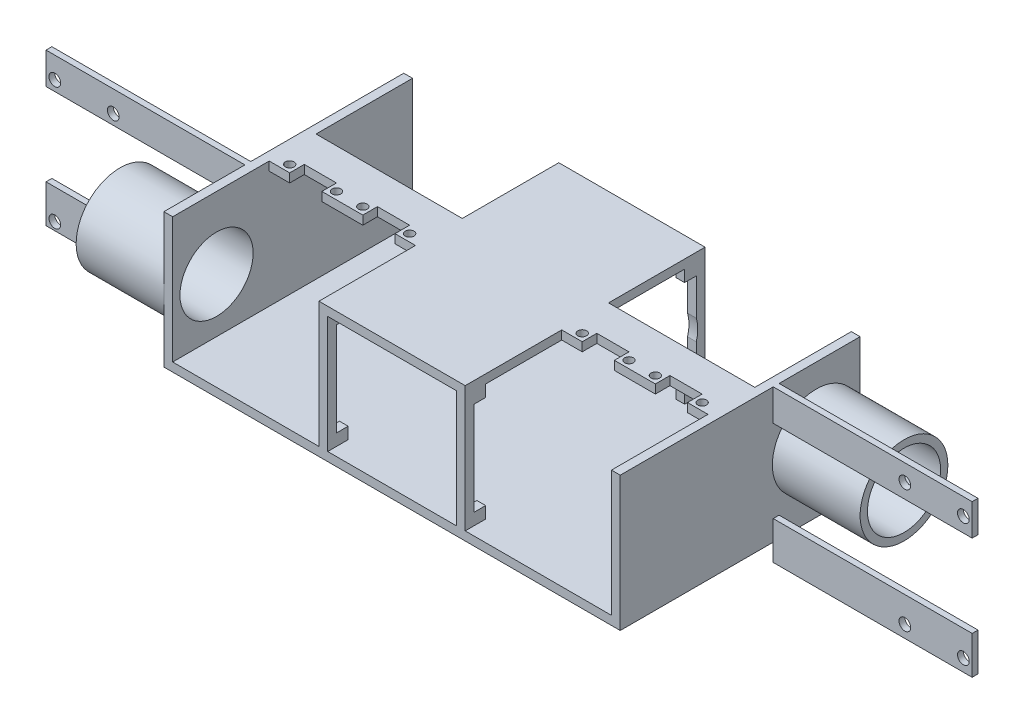
from build123d import *

# Parameters (mm, degrees)
SKETCH1_W               = 50
SKETCH1_H               = 46
BOSS_EXTRUDE1_DEPTH     = 41
CUT_EXTRUDE1_REACH      = 90.758
SKETCH2_W               = 44
SKETCH2_H               = 40
CUT_EXTRUDE2_DEPTH      = 69.629439747
CUT_EXTRUDE2_DEPTH_BACK = 69.629439747
SKETCH4_W               = 82
SKETCH4_H               = 3
BOSS_EXTRUDE2_DEPTH     = 50
SKETCH7_W               = 16
SKETCH7_H               = 3
BOSS_EXTRUDE4_DEPTH     = 50
SKETCH8_W               = 82
SKETCH8_H               = 46
BOSS_EXTRUDE5_DEPTH     = 3
CUT_EXTRUDE4_START      = -3
CUT_EXTRUDE4_DEPTH      = 103.403219264
CUT_EXTRUDE5_REACH      = 101.403
SKETCH10_W              = 11
SKETCH10_H              = 5
CUT_EXTRUDE6_REACH      = 101.403
SKETCH11_R              = 1.5
SKETCH12_R              = 15
BOSS_EXTRUDE6_DEPTH     = 30
SKETCH13_R              = 12.5
CUT_EXTRUDE7_DEPTH      = 142.063815346
SKETCH14_W              = 2
SKETCH14_H              = 10.8
SKETCH14_H_2            = 13
BOSS_EXTRUDE7_DEPTH     = 68
SKETCH16_R              = 15
BOSS_EXTRUDE8_DEPTH     = 30
CUT_EXTRUDE9_REACH      = 260.917
SKETCH17_R              = 12.5
SKETCH18_W              = 2
SKETCH18_H              = 10.8
BOSS_EXTRUDE9_DEPTH     = 68
SKETCH19_W              = 2
SKETCH19_H              = 13
BOSS_EXTRUDE10_DEPTH    = 68
CUT_EXTRUDE10_REACH     = 160.447
SKETCH15_R              = 2
CUT_EXTRUDE11_REACH     = 160.447
SKETCH20_R              = 2


with BuildPart() as part:
    # Sketch1 → Boss-Extrude1 (new, symmetric)
    with BuildSketch(Plane.XY):
        Rectangle(SKETCH1_W, SKETCH1_H)
    extrude(amount=BOSS_EXTRUDE1_DEPTH, both=True)

    # Sketch2 → Cut-Extrude1 (cut, up to next)
    with BuildSketch(Plane.XY.offset(41), mode=Mode.PRIVATE) as cut_extrude1_sk1:
        Rectangle(SKETCH2_W, SKETCH2_H)
    cut_extrude1_tool1 = extrude(cut_extrude1_sk1.sketch, amount=-CUT_EXTRUDE1_REACH, mode=Mode.PRIVATE) & part.part
    add(cut_extrude1_tool1.solids().sort_by_distance((0, 0, 41))[0], mode=Mode.SUBTRACT)

    # Sketch3 → Cut-Extrude2 (cut, two sides: drawn at the far end of the back side and taken through both)
    with BuildSketch(Plane.ZY.offset(25).offset(-CUT_EXTRUDE2_DEPTH_BACK)):
        Polygon((-34, 16), (-34, 20), (34, 20), (34, 16), (38, 16), (38, -16), (34, -16), (34, -20), (-34, -20), (-34, -16), (-38, -16), (-38, 16), align=None)
    extrude(amount=CUT_EXTRUDE2_DEPTH + CUT_EXTRUDE2_DEPTH_BACK, mode=Mode.SUBTRACT)

    # Sketch4 → Boss-Extrude2 (add)
    with BuildSketch(Plane(origin=(25, 0, 0), x_dir=(0, 0, -1), z_dir=(1, 0, 0))):
        with Locations((0, -21.5)):
            Rectangle(SKETCH4_W, SKETCH4_H)
    boss_extrude2 = extrude(amount=BOSS_EXTRUDE2_DEPTH)

    # Sketch7 → Boss-Extrude4 (add)
    with BuildSketch(Plane(origin=(25, 0, 0), x_dir=(0, 0, -1), z_dir=(1, 0, 0))):
        with Locations((0, 21.5)):
            Rectangle(SKETCH7_W, SKETCH7_H)
    boss_extrude4 = extrude(amount=BOSS_EXTRUDE4_DEPTH)

    # Sketch8 → Boss-Extrude5 (add)
    with BuildSketch(Plane(origin=(75, 0, 0), x_dir=(0, 0, -1), z_dir=(1, 0, 0))):
        Rectangle(SKETCH8_W, SKETCH8_H)
    boss_extrude5 = extrude(amount=BOSS_EXTRUDE5_DEPTH)

    # Sketch9 → Cut-Extrude4 (cut)
    with BuildSketch(Plane(origin=(0, 23, 0), x_dir=(1, 0, 0), z_dir=(0, 1, 0)).offset(CUT_EXTRUDE4_START)):
        Polygon((68, -228.237960416), (68, -8), (68, -3), (57, -3), (57, -8), (57, -228.237960416), (57, -668.713881249), (68, -668.713881249), align=None)
    cut_extrude4 = extrude(amount=CUT_EXTRUDE4_DEPTH, mode=Mode.SUBTRACT)

    # Sketch10 → Cut-Extrude5 (cut, up to next)
    with BuildSketch(Plane(origin=(0, 23, 0), x_dir=(1, 0, 0), z_dir=(0, 1, 0)), mode=Mode.PRIVATE) as cut_extrude5_sk1:
        with Locations((37.5, -5.5)):
            Rectangle(SKETCH10_W, SKETCH10_H)
    cut_extrude5_tool1 = extrude(cut_extrude5_sk1.sketch, amount=-CUT_EXTRUDE5_REACH, mode=Mode.PRIVATE) & part.part
    cut_extrude5 = cut_extrude5_tool1.solids().sort_by_distance((37.5, 23, 5.5))[0]
    add(cut_extrude5, mode=Mode.SUBTRACT)

    # Sketch11 → Cut-Extrude6 (cut, up to next)
    with BuildSketch(Plane(origin=(0, 23, 0), x_dir=(1, 0, 0), z_dir=(0, 1, 0)), mode=Mode.PRIVATE) as cut_extrude6_sk1:
        with Locations((29.5, -5.5)):
            Circle(SKETCH11_R)
    cut_extrude6_tool1 = extrude(cut_extrude6_sk1.sketch, amount=-CUT_EXTRUDE6_REACH, mode=Mode.PRIVATE) & part.part
    # Sketch11 → Cut-Extrude6 (cut, up to next)
    with BuildSketch(Plane(origin=(0, 23, 0), x_dir=(1, 0, 0), z_dir=(0, 1, 0)), mode=Mode.PRIVATE) as cut_extrude6_sk2:
        with Locations((45.5, -5.5)):
            Circle(SKETCH11_R)
    cut_extrude6_tool2 = extrude(cut_extrude6_sk2.sketch, amount=-CUT_EXTRUDE6_REACH, mode=Mode.PRIVATE) & part.part
    # Sketch11 → Cut-Extrude6 (cut, up to next)
    with BuildSketch(Plane(origin=(0, 23, 0), x_dir=(1, 0, 0), z_dir=(0, 1, 0)), mode=Mode.PRIVATE) as cut_extrude6_sk3:
        with Locations((54.5, -5.5)):
            Circle(SKETCH11_R)
    cut_extrude6_tool3 = extrude(cut_extrude6_sk3.sketch, amount=-CUT_EXTRUDE6_REACH, mode=Mode.PRIVATE) & part.part
    # Sketch11 → Cut-Extrude6 (cut, up to next)
    with BuildSketch(Plane(origin=(0, 23, 0), x_dir=(1, 0, 0), z_dir=(0, 1, 0)), mode=Mode.PRIVATE) as cut_extrude6_sk4:
        with Locations((70.5, -5.5)):
            Circle(SKETCH11_R)
    cut_extrude6_tool4 = extrude(cut_extrude6_sk4.sketch, amount=-CUT_EXTRUDE6_REACH, mode=Mode.PRIVATE) & part.part
    cut_extrude6_1 = cut_extrude6_tool1.solids().sort_by_distance((29.5, 23, 5.5))[0]
    add(cut_extrude6_1, mode=Mode.SUBTRACT)
    cut_extrude6_2 = cut_extrude6_tool2.solids().sort_by_distance((45.5, 23, 5.5))[0]
    add(cut_extrude6_2, mode=Mode.SUBTRACT)
    cut_extrude6_3 = cut_extrude6_tool3.solids().sort_by_distance((54.5, 23, 5.5))[0]
    add(cut_extrude6_3, mode=Mode.SUBTRACT)
    cut_extrude6_4 = cut_extrude6_tool4.solids().sort_by_distance((70.5, 23, 5.5))[0]
    add(cut_extrude6_4, mode=Mode.SUBTRACT)
    cut_extrude6 = cut_extrude6_1 + cut_extrude6_2 + cut_extrude6_3 + cut_extrude6_4  # Cut-Extrude6 as one shape, for the pattern or mirror that repeats it

    # Sketch12 → Boss-Extrude6 (add)
    with BuildSketch(Plane(origin=(78, 0, 0), x_dir=(0, 0, -1), z_dir=(1, 0, 0))):
        with Locations((26, 0)):
            Circle(SKETCH12_R)
    extrude(amount=BOSS_EXTRUDE6_DEPTH)

    # Sketch13 → Cut-Extrude7 (cut, through all)
    with BuildSketch(Plane(origin=(108, 0, 0), x_dir=(0, 0, -1), z_dir=(1, 0, 0))):
        with Locations((26, 0)):
            Circle(SKETCH13_R)
    extrude(amount=-CUT_EXTRUDE7_DEPTH, mode=Mode.SUBTRACT)

    # Sketch14 → Boss-Extrude7 (add)
    with BuildSketch(Plane(origin=(78, 0, 0), x_dir=(0, 0, -1), z_dir=(1, 0, 0))):
        with Locations((12.3, 17.6)):
            Rectangle(SKETCH14_W, SKETCH14_H)
        with Locations((12.3, -22.5)):
            Rectangle(SKETCH14_W, SKETCH14_H_2)
    extrude(amount=BOSS_EXTRUDE7_DEPTH)

    # Mirror1: Boss-Extrude2, Boss-Extrude4, Boss-Extrude5, Cut-Extrude4, Cut-Extrude5, Cut-Extrude6 across plane
    add(boss_extrude2.mirror(Plane(origin=(0, 0, 0), x_dir=(0, 0, 1), z_dir=(1, 0, 0))))
    add(boss_extrude4.mirror(Plane(origin=(0, 0, 0), x_dir=(0, 0, 1), z_dir=(1, 0, 0))))
    add(boss_extrude5.mirror(Plane(origin=(0, 0, 0), x_dir=(0, 0, 1), z_dir=(1, 0, 0))))
    add(cut_extrude4.mirror(Plane(origin=(0, 0, 0), x_dir=(0, 0, 1), z_dir=(1, 0, 0))), mode=Mode.SUBTRACT)
    add(cut_extrude5.mirror(Plane(origin=(0, 0, 0), x_dir=(0, 0, 1), z_dir=(1, 0, 0))), mode=Mode.SUBTRACT)
    add(cut_extrude6.mirror(Plane(origin=(0, 0, 0), x_dir=(0, 0, 1), z_dir=(1, 0, 0))), mode=Mode.SUBTRACT)

    # Sketch16 → Boss-Extrude8 (add)
    with BuildSketch(Plane.ZY.offset(78)):
        with Locations((26, -1.505120408)):
            Circle(SKETCH16_R)
    extrude(amount=BOSS_EXTRUDE8_DEPTH)

    # Sketch17 → Cut-Extrude9 (cut, up to next)
    with BuildSketch(Plane.ZY.offset(108), mode=Mode.PRIVATE) as cut_extrude9_sk1:
        with Locations((26, -1.505120408)):
            Circle(SKETCH17_R)
    cut_extrude9_tool1 = extrude(cut_extrude9_sk1.sketch, amount=-CUT_EXTRUDE9_REACH, mode=Mode.PRIVATE) & part.part
    add(cut_extrude9_tool1.solids().sort_by_distance((-108, -1.50512, 26))[0], mode=Mode.SUBTRACT)

    # Sketch18 → Boss-Extrude9 (add)
    with BuildSketch(Plane.ZY.offset(78)):
        with Locations((12.3, 17.6)):
            Rectangle(SKETCH18_W, SKETCH18_H)
    extrude(amount=BOSS_EXTRUDE9_DEPTH)

    # Sketch19 → Boss-Extrude10 (add)
    with BuildSketch(Plane.ZY.offset(78)):
        with Locations((12.3, -22.5)):
            Rectangle(SKETCH19_W, SKETCH19_H)
    extrude(amount=BOSS_EXTRUDE10_DEPTH)

    # Sketch15 → Cut-Extrude10 (cut, up to next)
    with BuildSketch(Plane(origin=(0, 0, -13.3), x_dir=(-1, 0, 0), z_dir=(0, 0, -1)), mode=Mode.PRIVATE) as cut_extrude10_sk1:
        with Locations((-143, -24.8)):
            Circle(SKETCH15_R)
    cut_extrude10_tool1 = extrude(cut_extrude10_sk1.sketch, amount=-CUT_EXTRUDE10_REACH, mode=Mode.PRIVATE) & part.part
    # Sketch15 → Cut-Extrude10 (cut, up to next)
    with BuildSketch(Plane(origin=(0, 0, -13.3), x_dir=(-1, 0, 0), z_dir=(0, 0, -1)), mode=Mode.PRIVATE) as cut_extrude10_sk2:
        with Locations((-123, -24.8)):
            Circle(SKETCH15_R)
    cut_extrude10_tool2 = extrude(cut_extrude10_sk2.sketch, amount=-CUT_EXTRUDE10_REACH, mode=Mode.PRIVATE) & part.part
    # Sketch15 → Cut-Extrude10 (cut, up to next)
    with BuildSketch(Plane(origin=(0, 0, -13.3), x_dir=(-1, 0, 0), z_dir=(0, 0, -1)), mode=Mode.PRIVATE) as cut_extrude10_sk3:
        with Locations((-123, 17.2)):
            Circle(SKETCH15_R)
    cut_extrude10_tool3 = extrude(cut_extrude10_sk3.sketch, amount=-CUT_EXTRUDE10_REACH, mode=Mode.PRIVATE) & part.part
    # Sketch15 → Cut-Extrude10 (cut, up to next)
    with BuildSketch(Plane(origin=(0, 0, -13.3), x_dir=(-1, 0, 0), z_dir=(0, 0, -1)), mode=Mode.PRIVATE) as cut_extrude10_sk4:
        with Locations((-143, 17.2)):
            Circle(SKETCH15_R)
    cut_extrude10_tool4 = extrude(cut_extrude10_sk4.sketch, amount=-CUT_EXTRUDE10_REACH, mode=Mode.PRIVATE) & part.part
    add(cut_extrude10_tool1.solids().sort_by_distance((143, -24.8, -13.3))[0], mode=Mode.SUBTRACT)
    add(cut_extrude10_tool2.solids().sort_by_distance((123, -24.8, -13.3))[0], mode=Mode.SUBTRACT)
    add(cut_extrude10_tool3.solids().sort_by_distance((123, 17.2, -13.3))[0], mode=Mode.SUBTRACT)
    add(cut_extrude10_tool4.solids().sort_by_distance((143, 17.2, -13.3))[0], mode=Mode.SUBTRACT)

    # Sketch20 → Cut-Extrude11 (cut, up to next)
    with BuildSketch(Plane.XY.offset(13.3), mode=Mode.PRIVATE) as cut_extrude11_sk1:
        with Locations((-123, 15.694879592)):
            Circle(SKETCH20_R)
    cut_extrude11_tool1 = extrude(cut_extrude11_sk1.sketch, amount=-CUT_EXTRUDE11_REACH, mode=Mode.PRIVATE) & part.part
    # Sketch20 → Cut-Extrude11 (cut, up to next)
    with BuildSketch(Plane.XY.offset(13.3), mode=Mode.PRIVATE) as cut_extrude11_sk2:
        with Locations((-143, 15.694879592)):
            Circle(SKETCH20_R)
    cut_extrude11_tool2 = extrude(cut_extrude11_sk2.sketch, amount=-CUT_EXTRUDE11_REACH, mode=Mode.PRIVATE) & part.part
    # Sketch20 → Cut-Extrude11 (cut, up to next)
    with BuildSketch(Plane.XY.offset(13.3), mode=Mode.PRIVATE) as cut_extrude11_sk3:
        with Locations((-123, -26.305120408)):
            Circle(SKETCH20_R)
    cut_extrude11_tool3 = extrude(cut_extrude11_sk3.sketch, amount=-CUT_EXTRUDE11_REACH, mode=Mode.PRIVATE) & part.part
    # Sketch20 → Cut-Extrude11 (cut, up to next)
    with BuildSketch(Plane.XY.offset(13.3), mode=Mode.PRIVATE) as cut_extrude11_sk4:
        with Locations((-143, -26.305120408)):
            Circle(SKETCH20_R)
    cut_extrude11_tool4 = extrude(cut_extrude11_sk4.sketch, amount=-CUT_EXTRUDE11_REACH, mode=Mode.PRIVATE) & part.part
    add(cut_extrude11_tool1.solids().sort_by_distance((-123, 15.69488, 13.3))[0], mode=Mode.SUBTRACT)
    add(cut_extrude11_tool2.solids().sort_by_distance((-143, 15.69488, 13.3))[0], mode=Mode.SUBTRACT)
    add(cut_extrude11_tool3.solids().sort_by_distance((-123, -26.30512, 13.3))[0], mode=Mode.SUBTRACT)
    add(cut_extrude11_tool4.solids().sort_by_distance((-143, -26.30512, 13.3))[0], mode=Mode.SUBTRACT)


solid = part.part
